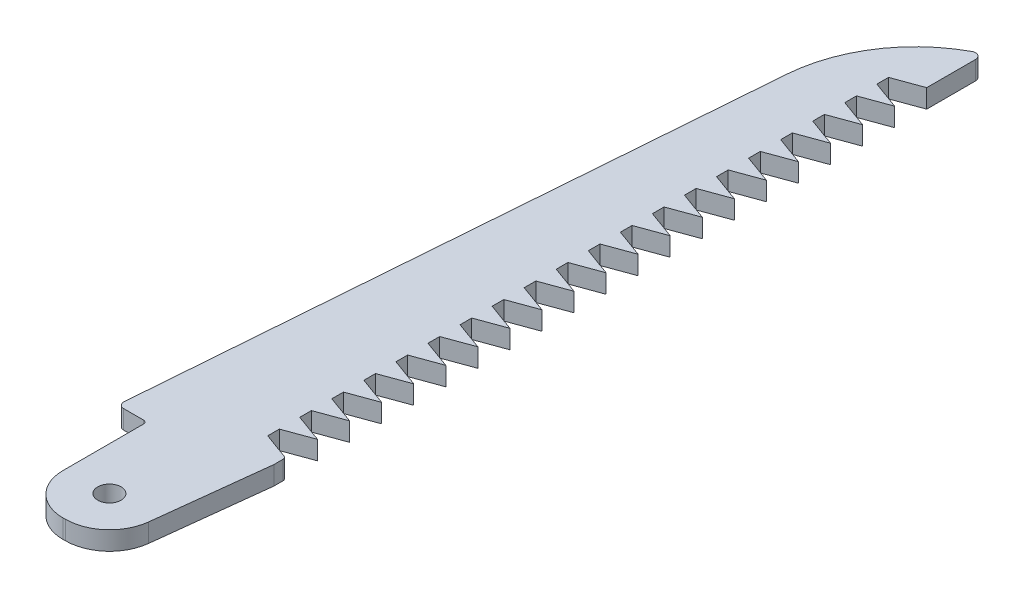
from build123d import *

# Parameters (mm, degrees)
SKETCH2_R           = 1
BOSS_EXTRUDE1_DEPTH = 1.6
FILLET1_R           = 3.8
SKETCH3_W           = 2.9
SKETCH3_H           = 10.72
CUT_EXTRUDE1_DEPTH  = 75.905340264
CUT_EXTRUDE2_DEPTH  = 75.905340264
FILLET2_R           = 0.5
LPATTERN1_COUNT     = 20
LPATTERN1_PITCH     = 2.75
CUT_EXTRUDE5_DEPTH  = 0.5
FILLET3_R           = 3
FILLET4_R           = 3.5
FILLET5_R           = 0.5
FILLET6_R           = 0.3


with BuildPart() as part:
    # Sketch2 → Boss-Extrude1 (new body)
    with BuildSketch(Plane(origin=(0, 0, 0), x_dir=(1, 0, 0), z_dir=(0, 1, 0))):
        with BuildLine():
            Line((0, 0), (0, 6))
            Line((0, 6), (4.5, 64))
            ThreePointArc((4.5, 64), (6.634239414, 69.95603241), (11.5, 74))
            Line((11.5, 74), (11.5, 13))
            Line((11.5, 13), (10, 0))
            Line((10, 0), (0, 0))
        make_face()
        with Locations(Location((6.6, 3.8, 0), (0, 0, 270))):
            Circle(SKETCH2_R, mode=Mode.SUBTRACT)
    extrude(amount=BOSS_EXTRUDE1_DEPTH)

    # Fillet1
    fillet1_edges = [part.edges().sort_by_distance(p)[0] for p in [
        (10, 0.8, 0),
    ]]
    fillet(fillet1_edges, radius=FILLET1_R)

    # Sketch3 → Cut-Extrude1 (cut, through all)
    with BuildSketch(Plane(origin=(0, 1.6, 0), x_dir=(1, 0, 0), z_dir=(0, 1, 0))):
        with Locations((1.45, 5.36)):
            Rectangle(SKETCH3_W, SKETCH3_H)
    extrude(amount=-CUT_EXTRUDE1_DEPTH, mode=Mode.SUBTRACT)

    # Sketch4 → Cut-Extrude2 (cut, through all)
    with BuildSketch(Plane(origin=(0, 1.6, 0), x_dir=(1, 0, 0), z_dir=(0, 1, 0))):
        Polygon((11.5, 69), (9.1, 68.125), (9.1, 67.125), (11.5, 66.25), align=None)
    cut_extrude2 = extrude(amount=-CUT_EXTRUDE2_DEPTH, mode=Mode.SUBTRACT)

    # Fillet2
    fillet2_edges = [part.edges().sort_by_distance(p)[0] for p in [
        (11.5, 0.8, -74),
    ]]
    fillet(fillet2_edges, radius=FILLET2_R)

    # LPattern1: Cut-Extrude2 ×20
    with Locations(*[(0, 0, i * LPATTERN1_PITCH) for i in range(1, LPATTERN1_COUNT)]):
        add(cut_extrude2, mode=Mode.SUBTRACT)

    # Sketch6 → Cut-Extrude5 (cut)
    with BuildSketch(Plane.XZ):
        with BuildLine():
            Line((5.74546219, -67.125), (4.930807018, -56.625))
            ThreePointArc((4.930807018, -56.625), (6.938890592, -61.750803415), (5.74546219, -67.125))
        make_face()
    extrude(amount=-CUT_EXTRUDE5_DEPTH, mode=Mode.SUBTRACT)

    # Fillet3
    # the kernel refuses this fillet: 3 mm, written as the material it adds along each edge
    with BuildSketch(Plane(origin=(-2.470700866, 0.5, -62.480857924), x_dir=(0.44582092023827286, 0, 0.8951221743862118), z_dir=(-0.8951221743862118, 0, 0.44582092023827286))) as fillet3_piece_1_section:
        with BuildLine():
            CenterArc((7.77955765, -3), FILLET3_R, 56.442690238, 33.557309762)
            Line((7.77955765, 0), (7.77955765, 0.06))
            Line((7.77955765, 0.06), (9.437870045, 0.06))
            Line((9.437870045, 0.06), (9.497870045, 0))
            ThreePointArc((9.497870045, 0), (9.497870045, -0.25), (9.471036293, -0.45))
            Line((9.471036293, -0.45), (9.437870045, -0.5))
        make_face()
    fillet3_piece_1 = revolve(axis=Axis((-2.470700866, 0.5, -62.480857924), (0, 1, 0)), revolution_arc=118.175305081, mode=Mode.PRIVATE)
    fillet3_piece_1 = split(fillet3_piece_1, bisect_by=Plane(origin=(5.338134618, 0.375117564, -61.875000174), z_dir=(0.997003710874575, 0, 0.07735373618854458)), keep=Keep.TOP, mode=Mode.PRIVATE)
    add(fillet3_piece_1)

    # Fillet4
    fillet4_edges = [part.edges().sort_by_distance(p)[0] for p in [
        (2.9, 0.8, 0),
    ]]
    fillet(fillet4_edges, radius=FILLET4_R)

    # Fillet5
    fillet5_edges = [part.edges().sort_by_distance(p)[0] for p in [
        (0.366206897, 0.8, -10.72),
    ]]
    fillet(fillet5_edges, radius=FILLET5_R)

    # Fillet6
    fillet6_edges = [part.edges().sort_by_distance(p)[0] for p in [
        (11.5, 0.8, -14),
        (2.9, 0.8, -10.72),
    ]]
    fillet(fillet6_edges, radius=FILLET6_R)


solid = part.part
